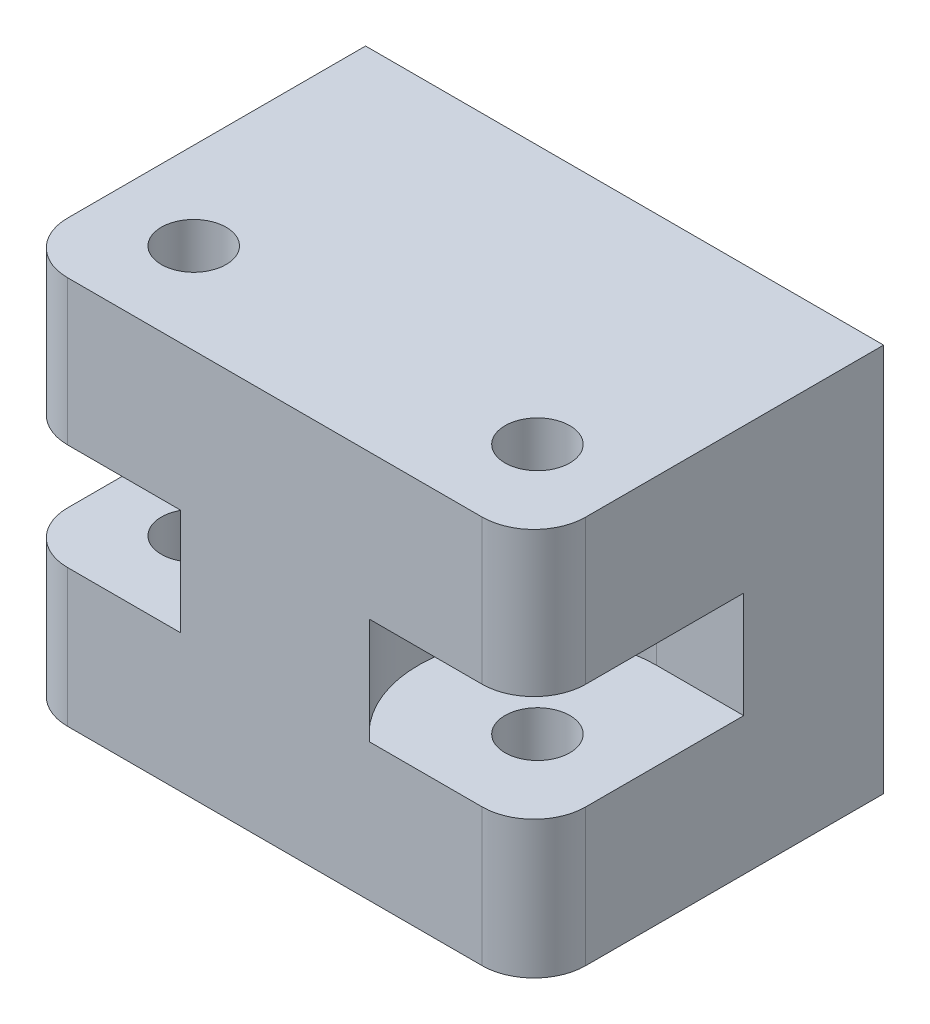
from build123d import *

# Parameters (mm, degrees)
SKETCH1_W           = 40
SKETCH1_H           = 27
BOSS_EXTRUDE1_DEPTH = 30
CUT_EXTRUDE1_DEPTH  = 10
SKETCH3_R           = 2.5
CUT_EXTRUDE2_DEPTH  = 30
CUT_EXTRUDE5_START  = -10.62
CUT_EXTRUDE5_DEPTH  = 8.2
SKETCH10_W          = 20
SKETCH10_H          = 8.2
CUT_EXTRUDE7_DEPTH  = 6.8
SKETCH12_W          = 20
SKETCH12_H          = 8.2
CUT_EXTRUDE10_DEPTH = 6.8
FILLET1_R           = 4


with BuildPart() as part:
    # Sketch1 → Boss-Extrude1 (new body)
    with BuildSketch(Plane(origin=(0, 0, 0), x_dir=(1, 0, 0), z_dir=(0, 1, 0))):
        with Locations((-2.846153846, 4.313186813)):
            Rectangle(SKETCH1_W, SKETCH1_H)
    extrude(amount=BOSS_EXTRUDE1_DEPTH)

    # Sketch2 → Cut-Extrude1 (cut)
    with BuildSketch(Plane(origin=(0, 0, -17.813186813), x_dir=(-1, 0, 0), z_dir=(0, 0, -1))):
        Polygon((-8.086431081, 26), (-8.086431081, 4), (-0.206431081, 4), (-0.206431081, 7), (-2.866431081, 7), (-2.866431081, 8.008707537), (-0.253846154, 10.628707537), (5.946153846, 10.628707537), (8.558738773, 8.008707537), (8.558738773, 7), (5.898738773, 7), (5.898738773, 4), (13.778738773, 4), (13.778738773, 26), (5.898738773, 26), (5.898738773, 23), (8.558738773, 23), (8.558738773, 21.991292463), (5.938738773, 19.378707537), (-0.246431081, 19.378707537), (-2.866431081, 21.991292463), (-2.866431081, 23), (-0.206431081, 23), (-0.206431081, 26), align=None)
    extrude(amount=-CUT_EXTRUDE1_DEPTH, mode=Mode.SUBTRACT)

    # Sketch3 → Cut-Extrude2 (cut)
    with BuildSketch(Plane.XZ):
        with Locations((10.423846154, 2.186813187)):
            Circle(SKETCH3_R)
        with Locations((-16.116153846, 2.186813187)):
            Circle(SKETCH3_R)
    extrude(amount=-CUT_EXTRUDE2_DEPTH, mode=Mode.SUBTRACT)

    # Sketch8 → Cut-Extrude5 (cut)
    with BuildSketch(Plane.XZ.offset(CUT_EXTRUDE5_START)):
        with BuildLine():
            Line((17.153846154, 9.186813187), (4.453921531, 9.186813187))
            ThreePointArc((4.453921531, 9.186813187), (1.791349412, -0.994381557), (10.423846154, -7.013186813))
            Line((10.423846154, -7.013186813), (17.153846154, -7.013186813))
            Line((17.153846154, -7.013186813), (17.153846154, 9.186813187))
        make_face()
        with BuildLine():
            ThreePointArc((-16.116153846, -7.013186813), (-7.483657104, -0.994381557), (-10.146229224, 9.186813187))
            Line((-10.146229224, 9.186813187), (-22.846153846, 9.186813187))
            Line((-22.846153846, 9.186813187), (-22.846153846, -7.013186813))
            Line((-22.846153846, -7.013186813), (-16.116153846, -7.013186813))
        make_face()
    extrude(amount=-CUT_EXTRUDE5_DEPTH, mode=Mode.SUBTRACT)

    # Sketch10 → Cut-Extrude7 (cut)
    with BuildSketch(Plane.ZY.offset(-8.086431081)):
        with Locations((-7.813186813, 14.72)):
            Rectangle(SKETCH10_W, SKETCH10_H)
    extrude(amount=CUT_EXTRUDE7_DEPTH, mode=Mode.SUBTRACT)

    # Sketch12 → Cut-Extrude10 (cut)
    with BuildSketch(Plane(origin=(-13.778738773, 0, 0), x_dir=(0, 0, -1), z_dir=(1, 0, 0))):
        with Locations((7.813186813, 14.72)):
            Rectangle(SKETCH12_W, SKETCH12_H)
    extrude(amount=CUT_EXTRUDE10_DEPTH, mode=Mode.SUBTRACT)

    # Fillet1
    fillet1_edges = [part.edges().sort_by_distance(p)[0] for p in [
        (17.153846154, 5.31, 9.186813187),
        (17.153846154, 24.41, 9.186813187),
        (-22.846153846, 5.31, 9.186813187),
        (-22.846153846, 24.41, 9.186813187),
    ]]
    fillet(fillet1_edges, radius=FILLET1_R)


solid = part.part
